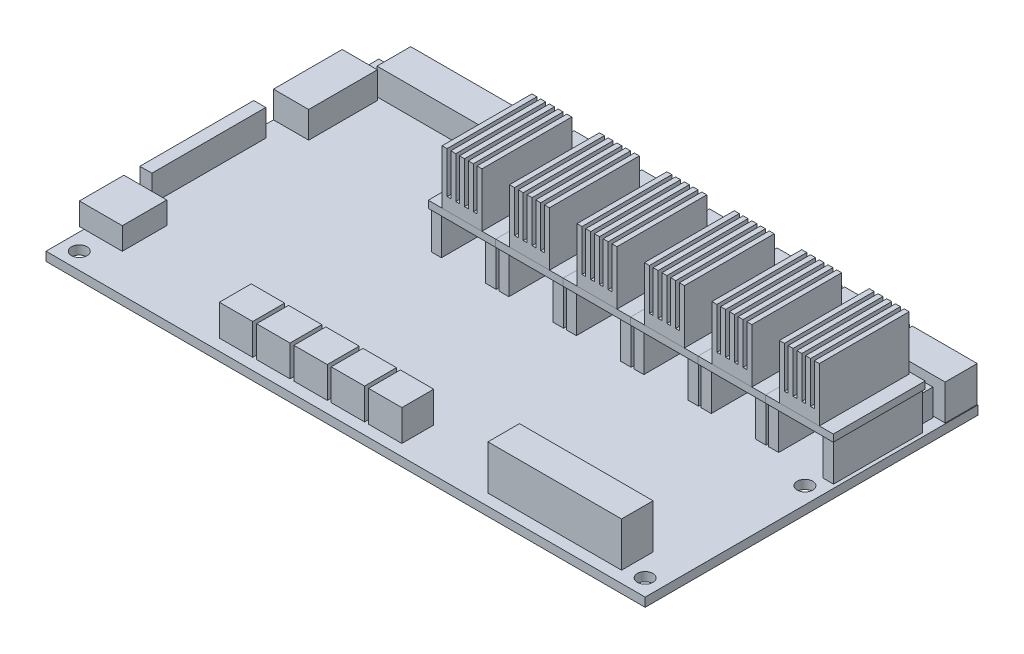
from build123d import *

# Parameters (mm, degrees)
SKETCH2_W             = 2.263130232
SKETCH2_H             = 20.080700397
BOSS_EXTRUDE1_DEPTH   = 8.5
SKETCH2_W_2           = 2.386522938
BOSS_EXTRUDE1_2_DEPTH = 8.5
SKETCH4_W             = 15.259003798
SKETCH4_H             = 20.708492539
BOSS_EXTRUDE4_DEPTH   = 1.6
BOSS_EXTRUDE5_DEPTH   = 20.25
SKETCH7_W             = 9.660970792
SKETCH7_H             = 10.033741369
BOSS_EXTRUDE6_DEPTH   = 5
SKETCH8_W             = 7.517858825
SKETCH8_H             = 7.182240128
BOSS_EXTRUDE7_DEPTH   = 7
LPATTERN2_COUNT       = 5
LPATTERN2_PITCH       = 8.4
SKETCH9_W             = 30.10373078
SKETCH9_H             = 7.103843348
BOSS_EXTRUDE8_DEPTH   = 10
SKETCH10_W            = 2.707119374
SKETCH10_H            = 25.664057005
BOSS_EXTRUDE9_DEPTH   = 6
SKETCH10_W_2          = 7.935709789
SKETCH10_H_2          = 15.483975616
BOSS_EXTRUDE9_2_DEPTH = 6
SKETCH10_W_3          = 36.655942274
SKETCH10_H_3          = 7.588116925
BOSS_EXTRUDE9_3_DEPTH = 6
SKETCH10_W_4          = 10.068560927
SKETCH10_H_4          = 2.697690188
BOSS_EXTRUDE9_4_DEPTH = 6
SKETCH10_W_5          = 10.202808406
BOSS_EXTRUDE9_5_DEPTH = 6
SKETCH10_W_6          = 10.269932146
BOSS_EXTRUDE9_6_DEPTH = 6
BOSS_EXTRUDE9_7_DEPTH = 6
SKETCH10_W_7          = 10.135684667
BOSS_EXTRUDE9_8_DEPTH = 6
SKETCH10_H_5          = 2.68329615
BOSS_EXTRUDE9_9_DEPTH = 6
SKETCH11_W            = 14.612327953
SKETCH11_H            = 7.226817495
BOSS_EXTRUDE10_DEPTH  = 8
LPATTERN3_COUNT       = 6
LPATTERN3_PITCH       = 15.25
SKETCH12_W            = 135
SKETCH12_H            = 75
SKETCH12_R            = 1.75
BOSS_EXTRUDE12_DEPTH  = 2


with BuildPart() as part:
    # Sketch2 → Boss-Extrude1 (new body)
    with BuildSketch(Plane(origin=(0, 0, 0), x_dir=(1, 0, 0), z_dir=(0, 1, 0))):
        with Locations((124.021102774, 109.864628282)):
            Rectangle(SKETCH2_W, SKETCH2_H)
    extrude(amount=BOSS_EXTRUDE1_DEPTH)


with BuildPart() as body_2:
    # Sketch2 → Boss-Extrude1 2 (new body)
    with BuildSketch(Plane(origin=(0, 0, 0), x_dir=(1, 0, 0), z_dir=(0, 1, 0))):
        with Locations((136.305685087, 109.864628282)):
            Rectangle(SKETCH2_W_2, SKETCH2_H)
    extrude(amount=BOSS_EXTRUDE1_2_DEPTH)


with BuildPart() as body_3:
    # Sketch4 → Boss-Extrude4 (new body)
    with BuildSketch(Plane(origin=(0, 8.5, 0), x_dir=(1, 0, 0), z_dir=(0, 1, 0))):
        with Locations((130.163640944, 109.829732326)):
            Rectangle(SKETCH4_W, SKETCH4_H)
    extrude(amount=BOSS_EXTRUDE4_DEPTH)


with BuildPart() as body_4:
    # Sketch6 → Boss-Extrude5 (new body)
    with BuildSketch(Plane.XY.offset(-99.475486056)):
        Polygon((125.647255669, 10.1), (134.647255669, 10.1), (134.647255669, 22.280332987), (133.52556774, 22.280332987), (133.52556774, 12.930169951), (132.677677652, 12.930169951), (132.677677652, 22.280332987), (131.555989722, 22.280332987), (131.555989722, 12.930169951), (130.708099634, 12.930169951), (130.708099634, 22.280332987), (129.586411705, 22.280332987), (129.586411705, 12.930169951), (128.738521616, 12.930169951), (128.738521616, 22.280332987), (127.616833687, 22.280332987), (127.616833687, 12.930169951), (126.768943599, 12.930169951), (126.768943599, 22.280332987), (125.647255669, 22.280332987), align=None)
    extrude(amount=-BOSS_EXTRUDE5_DEPTH)


with BuildPart() as body_5:
    # LPattern1: read off the stored shape, not the designer's step
    # LPattern1: copy of body 4
    add(body_4.part.moved(Location((76, 0, 0))))


with BuildPart() as body_6:
    # LPattern1 2: copy of body 4
    add(body_4.part.moved(Location((60.8, 0, 0))))


with BuildPart() as body_7:
    # LPattern1 3: copy of body 4
    add(body_4.part.moved(Location((45.6, 0, 0))))


with BuildPart() as body_8:
    # LPattern1 4: copy of body 4
    add(body_4.part.moved(Location((30.4, 0, 0))))


with BuildPart() as body_9:
    # LPattern1 5: copy of body 4
    add(body_4.part.moved(Location((15.2, 0, 0))))


with BuildPart() as body_10:
    # LPattern1 6: copy of body 3
    add(body_3.part.moved(Location((76, 0, 0))))


with BuildPart() as body_11:
    # LPattern1 7: copy of body 3
    add(body_3.part.moved(Location((60.8, 0, 0))))


with BuildPart() as body_12:
    # LPattern1 8: copy of body 3
    add(body_3.part.moved(Location((45.6, 0, 0))))


with BuildPart() as body_13:
    # LPattern1 9: copy of body 3
    add(body_3.part.moved(Location((30.4, 0, 0))))


with BuildPart() as body_14:
    # LPattern1 10: copy of body 3
    add(body_3.part.moved(Location((15.2, 0, 0))))


with BuildPart() as body_15:
    # LPattern1 11: copy of body 2
    add(body_2.part.moved(Location((76, 0, 0))))


with BuildPart() as body_16:
    # LPattern1 12: copy of part
    add(part.part.moved(Location((76, 0, 0))))


with BuildPart() as body_17:
    # LPattern1 13: copy of body 2
    add(body_2.part.moved(Location((60.8, 0, 0))))


with BuildPart() as body_18:
    # LPattern1 14: copy of part
    add(part.part.moved(Location((60.8, 0, 0))))


with BuildPart() as body_19:
    # LPattern1 15: copy of body 2
    add(body_2.part.moved(Location((45.6, 0, 0))))


with BuildPart() as body_20:
    # LPattern1 16: copy of part
    add(part.part.moved(Location((45.6, 0, 0))))


with BuildPart() as body_21:
    # LPattern1 17: copy of body 2
    add(body_2.part.moved(Location((30.4, 0, 0))))


with BuildPart() as body_22:
    # LPattern1 18: copy of part
    add(part.part.moved(Location((30.4, 0, 0))))


with BuildPart() as body_23:
    # LPattern1 19: copy of body 2
    add(body_2.part.moved(Location((15.2, 0, 0))))


with BuildPart() as body_24:
    # LPattern1 20: copy of part
    add(part.part.moved(Location((15.2, 0, 0))))


with BuildPart() as body_25:
    # Sketch7 → Boss-Extrude6 (new body)
    with BuildSketch(Plane(origin=(0, 0, 0), x_dir=(1, 0, 0), z_dir=(0, 1, 0))):
        with Locations((83.104559361, 70.146980197)):
            Rectangle(SKETCH7_W, SKETCH7_H)
    extrude(amount=BOSS_EXTRUDE6_DEPTH)


with BuildPart() as body_26:
    # Sketch8 → Boss-Extrude7 (new body)
    with BuildSketch(Plane(origin=(0, 0, 0), x_dir=(1, 0, 0), z_dir=(0, 1, 0))):
        with Locations((119.569180625, 62.721579773)):
            Rectangle(SKETCH8_W, SKETCH8_H)
    boss_extrude7 = extrude(amount=BOSS_EXTRUDE7_DEPTH)


with BuildPart() as lpattern2_1:
    # LPattern2: Boss-Extrude7 ×5
    with Locations(*[(i * LPATTERN2_PITCH, 0, 0) for i in range(1, LPATTERN2_COUNT)]):
        add(boss_extrude7)


with BuildPart() as body_31:
    # Sketch9 → Boss-Extrude8 (new body)
    with BuildSketch(Plane(origin=(0, 0, 0), x_dir=(1, 0, 0), z_dir=(0, 1, 0))):
        with Locations((191.360466938, 62.70153744)):
            Rectangle(SKETCH9_W, SKETCH9_H)
    extrude(amount=BOSS_EXTRUDE8_DEPTH)


with BuildPart() as body_32:
    # Sketch10 → Boss-Extrude9 (new body)
    with BuildSketch(Plane(origin=(0, 0, 0), x_dir=(1, 0, 0), z_dir=(0, 1, 0))):
        with Locations((80.674369511, 90.541314989)):
            Rectangle(SKETCH10_W, SKETCH10_H)
    extrude(amount=BOSS_EXTRUDE9_DEPTH)


with BuildPart() as body_33:
    # Sketch10 → Boss-Extrude9 2 (new body)
    with BuildSketch(Plane(origin=(0, 0, 0), x_dir=(1, 0, 0), z_dir=(0, 1, 0))):
        with Locations((83.288664719, 115.551308514)):
            Rectangle(SKETCH10_W_2, SKETCH10_H_2)
    extrude(amount=BOSS_EXTRUDE9_2_DEPTH)


with BuildPart() as body_34:
    # Sketch10 → Boss-Extrude9 3 (new body)
    with BuildSketch(Plane(origin=(0, 0, 0), x_dir=(1, 0, 0), z_dir=(0, 1, 0))):
        with Locations((104.817063387, 127.764496576)):
            Rectangle(SKETCH10_W_3, SKETCH10_H_3)
    extrude(amount=BOSS_EXTRUDE9_3_DEPTH)


with BuildPart() as body_35:
    # Sketch10 → Boss-Extrude9 4 (new body)
    with BuildSketch(Plane(origin=(0, 0, 0), x_dir=(1, 0, 0), z_dir=(0, 1, 0))):
        with Locations((130.601683976, 122.621593019)):
            Rectangle(SKETCH10_W_4, SKETCH10_H_4)
    extrude(amount=BOSS_EXTRUDE9_4_DEPTH)


with BuildPart() as body_36:
    # Sketch10 → Boss-Extrude9 5 (new body)
    with BuildSketch(Plane(origin=(0, 0, 0), x_dir=(1, 0, 0), z_dir=(0, 1, 0))):
        with Locations((145.771649106, 122.621593019)):
            Rectangle(SKETCH10_W_5, SKETCH10_H_4)
    extrude(amount=BOSS_EXTRUDE9_5_DEPTH)


with BuildPart() as body_37:
    # Sketch10 → Boss-Extrude9 6 (new body)
    with BuildSketch(Plane(origin=(0, 0, 0), x_dir=(1, 0, 0), z_dir=(0, 1, 0))):
        with Locations((161.243671065, 122.621593019)):
            Rectangle(SKETCH10_W_6, SKETCH10_H_4)
    extrude(amount=BOSS_EXTRUDE9_6_DEPTH)


with BuildPart() as body_38:
    # Sketch10 → Boss-Extrude9 7 (new body)
    with BuildSketch(Plane(origin=(0, 0, 0), x_dir=(1, 0, 0), z_dir=(0, 1, 0))):
        with Locations((176.145141237, 122.621593019)):
            Rectangle(SKETCH10_W_6, SKETCH10_H_4)
    extrude(amount=BOSS_EXTRUDE9_7_DEPTH)


with BuildPart() as body_39:
    # Sketch10 → Boss-Extrude9 8 (new body)
    with BuildSketch(Plane(origin=(0, 0, 0), x_dir=(1, 0, 0), z_dir=(0, 1, 0))):
        with Locations((191.583601327, 122.621593019)):
            Rectangle(SKETCH10_W_7, SKETCH10_H_4)
    extrude(amount=BOSS_EXTRUDE9_8_DEPTH)


with BuildPart() as body_40:
    # Sketch10 → Boss-Extrude9 9 (new body)
    with BuildSketch(Plane(origin=(0, 0, 0), x_dir=(1, 0, 0), z_dir=(0, 1, 0))):
        with Locations((206.619318978, 122.614396)):
            Rectangle(SKETCH10_W_6, SKETCH10_H_5)
    extrude(amount=BOSS_EXTRUDE9_9_DEPTH)


with BuildPart() as body_41:
    # Sketch11 → Boss-Extrude10 (new body)
    with BuildSketch(Plane(origin=(0, 0, 0), x_dir=(1, 0, 0), z_dir=(0, 1, 0))):
        with Locations((130.593919419, 127.945146291)):
            Rectangle(SKETCH11_W, SKETCH11_H)
    boss_extrude10 = extrude(amount=BOSS_EXTRUDE10_DEPTH)


with BuildPart() as lpattern3_1:
    # LPattern3: Boss-Extrude10 ×6
    with Locations(*[(i * LPATTERN3_PITCH, 0, 0) for i in range(1, LPATTERN3_COUNT)]):
        add(boss_extrude10)


with BuildPart() as body_47:
    # Sketch12 → Boss-Extrude12 (new body)
    with BuildSketch(Plane(origin=(0, 0, 0), x_dir=(1, 0, 0), z_dir=(0, 1, 0))):
        with Locations((146.820809824, 94.058555038)):
            Rectangle(SKETCH12_W, SKETCH12_H)
        with Locations(Location((83.070809824, 127.808555038, 0), (0, 0, 270))):
            Circle(SKETCH12_R, mode=Mode.SUBTRACT)
        with Locations(Location((83.070809824, 60.308555038, 0), (0, 0, 270))):
            Circle(SKETCH12_R, mode=Mode.SUBTRACT)
        with Locations(Location((210.570809824, 60.308555038, 0), (0, 0, 270))):
            Circle(SKETCH12_R, mode=Mode.SUBTRACT)
        with Locations(Location((210.570809824, 96.308555038, 0), (0, 0, 270))):
            Circle(SKETCH12_R, mode=Mode.SUBTRACT)
    extrude(amount=-BOSS_EXTRUDE12_DEPTH)


solid = Compound([part.part, body_2.part, body_3.part, body_4.part, body_5.part, body_6.part, body_7.part, body_8.part, body_9.part, body_10.part, body_11.part, body_12.part, body_13.part, body_14.part, body_15.part, body_16.part, body_17.part, body_18.part, body_19.part, body_20.part, body_21.part, body_22.part, body_23.part, body_24.part, body_25.part, body_26.part, lpattern2_1.part, body_31.part, body_32.part, body_33.part, body_34.part, body_35.part, body_36.part, body_37.part, body_38.part, body_39.part, body_40.part, body_41.part, lpattern3_1.part, body_47.part])
